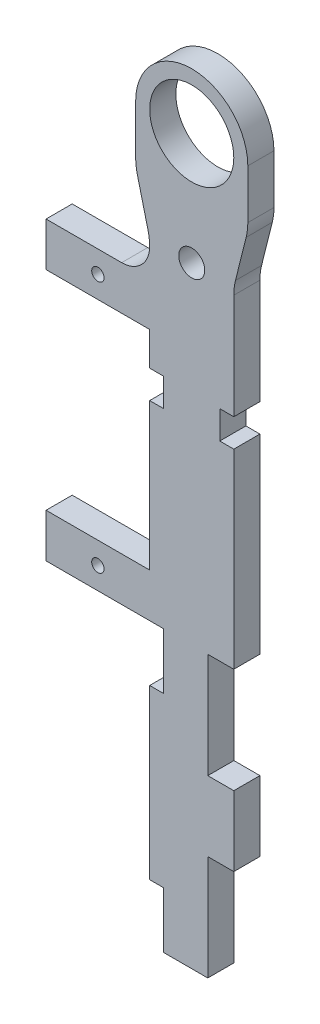
from build123d import *

# Parameters (mm, degrees)
SKETCH1_R             = 3.175
BOSS_EXTRUDE1_DEPTH   = 2.9591
SKETCH8_W             = 1.5875
SKETCH8_H             = 3.175
CUT_EXTRUDE4_DEPTH    = 50.215431564
SKETCH4_W             = 11.7348
SKETCH4_H             = 4.9657
BOSS_EXTRUDE2_DEPTH   = 2.9591
FILLET1_R             = 3.175
F_0_CLEARANCE_HOLE1_D = 1.397
F_4_CLEARANCE_HOLE1_D = 2.9464
BOSS_EXTRUDE3_START   = -2.9591
BOSS_EXTRUDE3_DEPTH   = 2.9591
FILLET2_R             = 6.35
CUT_EXTRUDE5_REACH    = 53.688
SKETCH12_R            = 4.7625


with BuildPart() as part:
    # Sketch1 → Boss-Extrude1 (new body)
    with BuildSketch(Plane.XY):
        with BuildLine():
            Line((4.7625, 33.02), (4.7625, -17.145))
            Line((4.7625, -17.145), (1.8161, -17.145))
            Line((1.8161, -17.145), (1.8161, -29.05125))
            Line((1.8161, -29.05125), (4.7625, -29.05125))
            Line((4.7625, -29.05125), (4.7625, -36.98875))
            Line((4.7625, -36.98875), (1.8161, -36.98875))
            Line((1.8161, -36.98875), (1.8161, -48.895))
            Line((1.8161, -48.895), (-3.175, -48.895))
            Line((-3.175, -48.895), (-3.175, -42.545))
            Line((-3.175, -42.545), (-4.7625, -42.545))
            Line((-4.7625, -42.545), (-4.7625, -23.495))
            Line((-4.7625, -23.495), (-3.175, -23.495))
            Line((-3.175, -23.495), (-3.175, -17.145))
            Line((-3.175, -17.145), (-4.7625, -17.145))
            Line((-4.7625, -17.145), (-4.7625, 33.02))
            ThreePointArc((-4.7625, 33.02), (0, 37.7825), (4.7625, 33.02))
        make_face()
        with Locations((0, 33.02)):
            Circle(SKETCH1_R, mode=Mode.SUBTRACT)
    extrude(amount=BOSS_EXTRUDE1_DEPTH)

    # Sketch8 → Cut-Extrude4 (cut, through all)
    with BuildSketch(Plane(origin=(0, 0, 0), x_dir=(-1, 0, 0), z_dir=(0, 0, -1))):
        with Locations((-3.96875, 6.0325)):
            Rectangle(SKETCH8_W, SKETCH8_H)
        with Locations((3.96875, 6.0325)):
            Rectangle(SKETCH8_W, SKETCH8_H)
    extrude(amount=-CUT_EXTRUDE4_DEPTH, mode=Mode.SUBTRACT)

    # Sketch4 → Boss-Extrude2 (add)
    with BuildSketch(Plane.XY.offset(2.9591)):
        with Locations((-10.6299, 13.90015)):
            Rectangle(SKETCH4_W, SKETCH4_H)
        with Locations((-10.6299, -14.66215)):
            Rectangle(SKETCH4_W, SKETCH4_H)
    extrude(amount=-BOSS_EXTRUDE2_DEPTH)

    # Fillet1
    fillet1_edges = [part.edges().sort_by_distance(p)[0] for p in [
        (-4.7625, 16.383, 1.47955),
    ]]
    fillet(fillet1_edges, radius=FILLET1_R)

    # #0 Clearance Hole1 (through all)
    with Locations(Plane(origin=(0, 0, 0), x_dir=(-1, 0, 0), z_dir=(0, 0, -1))):
        with Locations((10.6299, 13.90015), (10.6299, -14.66215)):
            Hole(F_0_CLEARANCE_HOLE1_D / 2)

    # #4 Clearance Hole1 (through all)
    with Locations(Plane.XY.offset(2.9591)):
        with Locations((0, 20.32)):
            Hole(F_4_CLEARANCE_HOLE1_D / 2)

    # Sketch11 → Boss-Extrude3 (add)
    with BuildSketch(Plane.XY.offset(2.9591).offset(BOSS_EXTRUDE3_START)):
        with BuildLine():
            Line((-6.35, 33.02), (-6.35, 26.67))
            Line((-6.35, 26.67), (-4.7625, 20.32))
            Line((-4.7625, 20.32), (-4.7625, 33.02))
            ThreePointArc((-4.7625, 33.02), (0, 37.7825), (4.7625, 33.02))
            Line((4.7625, 33.02), (4.7625, 20.32))
            Line((4.7625, 20.32), (6.35, 26.67))
            Line((6.35, 26.67), (6.35, 33.02))
            ThreePointArc((6.35, 33.02), (0, 39.37), (-6.35, 33.02))
        make_face()
    extrude(amount=BOSS_EXTRUDE3_DEPTH)

    # Fillet2
    # the kernel refuses this fillet: 6.35 mm, written as the material it adds along each edge
    with BuildSketch(Plane(origin=(4.7625, 20.32, 0), x_dir=(0, -1, 0), z_dir=(0, 0, 1))) as fillet2_piece_1:
        with BuildLine():
            CenterArc((FILLET2_R * 0.123105625618, FILLET2_R), FILLET2_R, 255.963756532, 14.036243468)
            Line((-FILLET2_R * 0.119429999419, FILLET2_R * 0.0298574998547), (0, 0))
            Line((0, 0), (FILLET2_R * 0.123105625618, 0))
        make_face()
    extrude(amount=2.9591)
    with BuildSketch(Plane(origin=(-4.7625, 20.32, 0), x_dir=(-8.465505129601726e-05, -0.9999999964167612, 0), z_dir=(0, 0, 1))) as fillet2_piece_2_section:
        with BuildLine():
            CenterArc((0.78250954, -6.349870963), FILLET2_R, 90.365265554, 13.675828291)
            Line((-0.758113183, -0.189596486), (-0.912175455, 0.426430961))
            Line((-0.912175455, 0.426430961), (-0.154062272, 0.616027448))
            Line((-0.154062272, 0.616027448), (-5.3756e-05, 0.634999998))
            ThreePointArc((-5.3756e-05, 0.634999998), (0.761946241, 0.635064505), (0.737979862, 0.634987096))
            Line((0.737979862, 0.634987096), (0.742028014, 0))
        make_face()
    fillet2_piece_2 = extrude(amount=2.9591, mode=Mode.PRIVATE)
    fillet2_piece_2 = split(fillet2_piece_2, bisect_by=Plane(origin=(-4.799885723, 7.62, 1.47955), z_dir=(0, 1, 0)), keep=Keep.TOP, mode=Mode.PRIVATE)
    fillet2_piece_2 = split(fillet2_piece_2, bisect_by=Plane(origin=(-3.175, 20.335301711, 1.47955), z_dir=(-1, 0, 0)), keep=Keep.TOP, mode=Mode.PRIVATE)
    add(fillet2_piece_2)
    # the kernel refuses this fillet: 6.35 mm, written as the material it takes off along each edge
    with BuildSketch(Plane(origin=(6.35, 26.67, -1.954301807), x_dir=(0, 1, 0), z_dir=(0, 0, 1))) as fillet2_2_piece_1:
        with BuildLine():
            CenterArc((FILLET2_R * 0.123105625618, FILLET2_R), FILLET2_R, 255.963756532, 14.036243468)
            Line((-FILLET2_R * 0.119429999419, FILLET2_R * 0.0298574998547), (0, 0))
            Line((0, 0), (FILLET2_R * 0.123105625618, 0))
        make_face()
    extrude(amount=6.867703613, mode=Mode.SUBTRACT)
    with BuildSketch(Plane(origin=(-6.35, 26.67, -1.954301807), x_dir=(0, 1, 0), z_dir=(0, 0, 1))) as fillet2_2_piece_2:
        with BuildLine():
            CenterArc((FILLET2_R * 0.123105625618, -FILLET2_R), FILLET2_R, 90, 14.036243468)
            Line((-FILLET2_R * 0.119429999419, -FILLET2_R * 0.0298574998547), (0, 0))
            Line((0, 0), (FILLET2_R * 0.123105625618, 0))
        make_face()
    extrude(amount=6.867703613, mode=Mode.SUBTRACT)

    # Sketch12 → Cut-Extrude5 (cut, up to next)
    with BuildSketch(Plane.XY.offset(2.9591), mode=Mode.PRIVATE) as cut_extrude5_sk1:
        with Locations((0, 33.02)):
            Circle(SKETCH12_R)
    cut_extrude5_tool1 = extrude(cut_extrude5_sk1.sketch, amount=-CUT_EXTRUDE5_REACH, mode=Mode.PRIVATE) & part.part
    add(cut_extrude5_tool1.solids().sort_by_distance((0, 33.02, 2.9591))[0], mode=Mode.SUBTRACT)


solid = part.part
